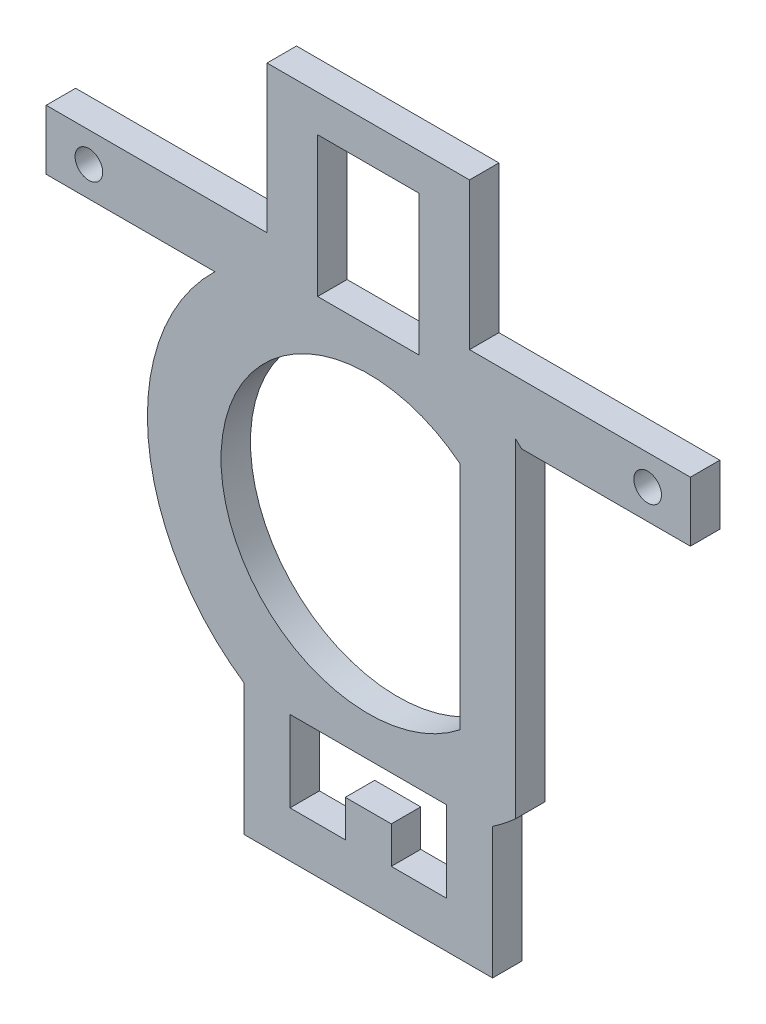
from build123d import *

# Parameters (mm, degrees)
SKETCH1_W           = 5.5
SKETCH1_H           = 7.612305333
SKETCH1_R           = 0.75
BOSS_EXTRUDE1_DEPTH = 1.6


with BuildPart() as part:
    # Sketch1 → Boss-Extrude1 (new body)
    with BuildSketch(Plane.XY):
        with BuildLine():
            Line((-5.5, 11.882694667), (-17.5, 11.882694667))
            Line((-17.5, 11.882694667), (-17.5, 8.632694667))
            Line((-17.5, 8.632694667), (-8.335261411, 8.632694667))
            ThreePointArc((-8.335261411, 8.632694667), (-11.956670593, -1.018836756), (-6.7545, -9.918504411))
            Line((-6.7545, -9.918504411), (-6.7545, -17.054889955))
            Line((-6.7545, -17.054889955), (6.7545, -17.054889955))
            Line((6.7545, -17.054889955), (6.7545, -9.918504411))
            ThreePointArc((6.7545, -9.918504411), (7.388032232, -9.456055189), (7.99, -8.95320613))
            Line((7.99, -8.95320613), (7.99, 8.95320613))
            ThreePointArc((7.99, 8.95320613), (8.164203693, 8.794644852), (8.335261411, 8.632694667))
            Line((8.335261411, 8.632694667), (17.5, 8.632694667))
            Line((17.5, 8.632694667), (17.5, 11.882694667))
            Line((17.5, 11.882694667), (5.5, 11.882694667))
            Line((5.5, 11.882694667), (5.5, 19.87))
            Line((5.5, 19.87), (-5.5, 19.87))
            Line((-5.5, 19.87), (-5.5, 11.882694667))
        make_face()
        with Locations((0, 14.063847334)):
            Rectangle(SKETCH1_W, SKETCH1_H, mode=Mode.SUBTRACT)
        with Locations((-15.18, 10.257694667)):
            Circle(SKETCH1_R, mode=Mode.SUBTRACT)
        with BuildLine():
            ThreePointArc((4.99, -6.252991284), (-8, 0), (4.99, 6.252991284))
            Line((4.99, 6.252991284), (4.99, -6.252991284))
        make_face(mode=Mode.SUBTRACT)
        Polygon((4.2545, -10.154889955), (4.2545, -14.554889955), (1.25, -14.554889955), (1.25, -12.554889955), (-1.25, -12.554889955), (-1.25, -14.554889955), (-4.2545, -14.554889955), (-4.2545, -10.154889955), align=None, mode=Mode.SUBTRACT)
        with Locations((15.18, 10.257694667)):
            Circle(SKETCH1_R, mode=Mode.SUBTRACT)
    extrude(amount=BOSS_EXTRUDE1_DEPTH)


solid = part.part
